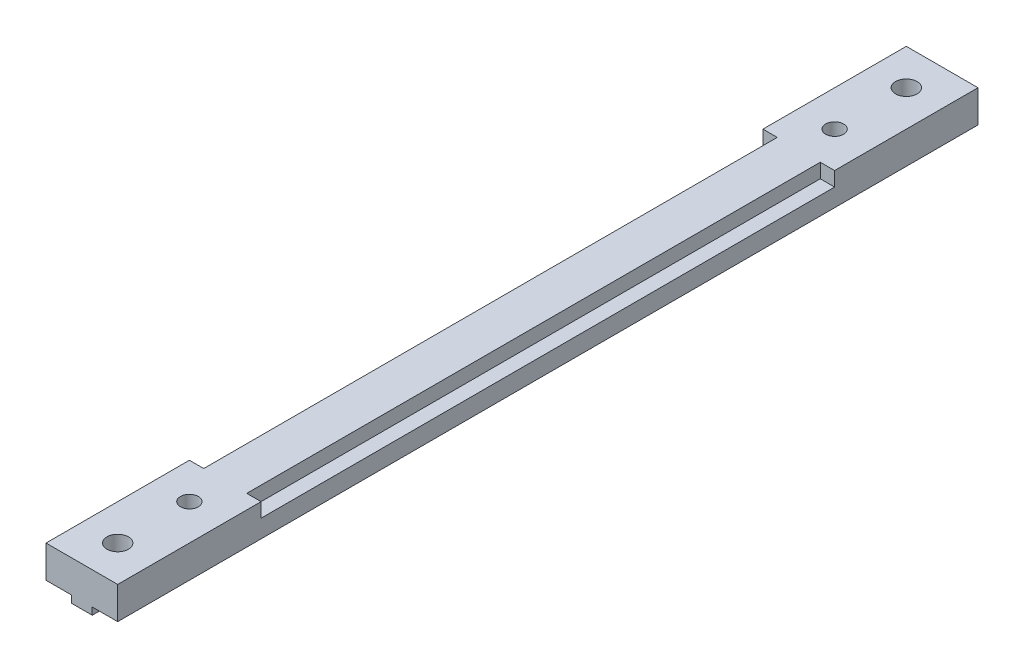
from build123d import *

# Parameters (mm, degrees)
MAIN_DEPTH      = 120
SKETCH2_R       = 1.25
SKETCH2_R_2     = 1.5
MAINHOLES_DEPTH = 121.22998794
SKETCH3_W       = 2
SKETCH3_H       = 80
PINHOLES_DEPTH  = 2


with BuildPart() as part:
    # Sketch1 → Main (new body)
    with BuildSketch(Plane.XY):
        Polygon((-5, 0), (5, 0), (5, -4.5), (1.45, -4.5), (1.45, -5.5), (-1.45, -5.5), (-1.45, -4.5), (-5, -4.5), align=None)
    extrude(amount=MAIN_DEPTH)

    # Sketch2 → MainHoles (cut, through all)
    with BuildSketch(Plane(origin=(0, 0, 0), x_dir=(1, 0, 0), z_dir=(0, 1, 0))):
        with Locations((0, -105)):
            Circle(SKETCH2_R)
        with Locations((0, -15)):
            Circle(SKETCH2_R)
        with Locations((0, -5)):
            Circle(SKETCH2_R_2)
        with Locations((0, -115)):
            Circle(SKETCH2_R_2)
    extrude(amount=-MAINHOLES_DEPTH, mode=Mode.SUBTRACT)

    # Sketch3 → PinHoles (cut)
    with BuildSketch(Plane(origin=(0, 0, 0), x_dir=(1, 0, 0), z_dir=(0, 1, 0))):
        with Locations((-4, -60)):
            Rectangle(SKETCH3_W, SKETCH3_H)
        with Locations((4, -60)):
            Rectangle(SKETCH3_W, SKETCH3_H)
    extrude(amount=-PINHOLES_DEPTH, mode=Mode.SUBTRACT)


solid = part.part
